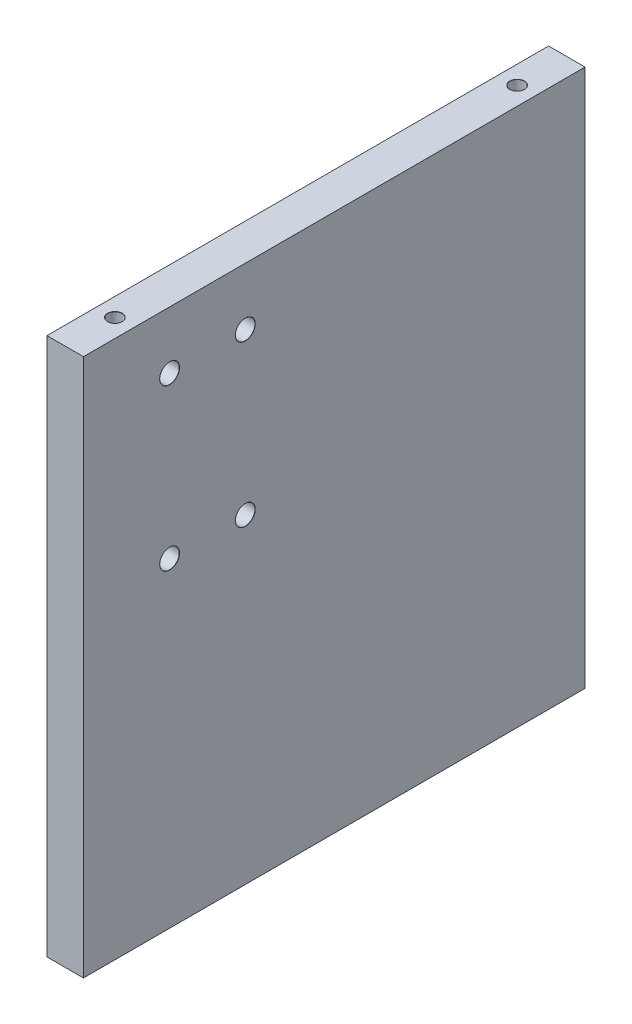
from build123d import *

# Parameters (mm, degrees)
SKETCH1_W                             = 87.3
SKETCH1_H                             = 93.65
BOSS_EXTRUDE1_DEPTH                   = 6.35
TAP_DRILL_FOR_M3X0_5_TAP1_D           = 2.5
TAP_DRILL_FOR_M3X0_5_TAP1_DEPTH       = 10
TAP_DRILL_FOR_M3X0_5_TAP1_CSINK_D     = 2.55
TAP_DRILL_FOR_M3X0_5_TAP1_CSINK_ANGLE = 90
TAP_DRILL_FOR_M3X0_5_TAP1_TIP         = 0.751075774
TAP_DRILL_FOR_M3X0_5_TAP2_D           = 2.5
TAP_DRILL_FOR_M3X0_5_TAP2_DEPTH       = 9.248924226
TAP_DRILL_FOR_M3X0_5_TAP2_CSINK_D     = 2.55
TAP_DRILL_FOR_M3X0_5_TAP2_CSINK_ANGLE = 90
TAP_DRILL_FOR_M3X0_5_TAP2_TIP         = 0.751075774
M3_CLEARANCE_HOLE2_D                  = 3.4
M3_CLEARANCE_HOLE2_CSINK_D            = 3.45
M3_CLEARANCE_HOLE2_CSINK_ANGLE        = 90


with BuildPart() as part:
    # Sketch1 → Boss-Extrude1 (new body)
    with BuildSketch(Plane(origin=(0, 0, 0), x_dir=(0, 0, -1), z_dir=(1, 0, 0))):
        Rectangle(SKETCH1_W, SKETCH1_H)
    extrude(amount=BOSS_EXTRUDE1_DEPTH)

    # Tap Drill for M3x0.5 Tap1
    with Locations(Plane(origin=(0, 46.825, 0), x_dir=(1, 0, 0), z_dir=(0, 1, 0))):
        with Locations((3.175, 35), (3.175, -35)):
            CounterSinkHole(TAP_DRILL_FOR_M3X0_5_TAP1_D / 2, TAP_DRILL_FOR_M3X0_5_TAP1_CSINK_D / 2, depth=TAP_DRILL_FOR_M3X0_5_TAP1_DEPTH, counter_sink_angle=TAP_DRILL_FOR_M3X0_5_TAP1_CSINK_ANGLE)
            with Locations((0, 0, -(TAP_DRILL_FOR_M3X0_5_TAP1_DEPTH + TAP_DRILL_FOR_M3X0_5_TAP1_TIP / 2))):  # 118° drill point
                Cone(0, TAP_DRILL_FOR_M3X0_5_TAP1_D / 2, TAP_DRILL_FOR_M3X0_5_TAP1_TIP, mode=Mode.SUBTRACT)

    # Tap Drill for M3x0.5 Tap2
    with Locations(Plane(origin=(0, -46.825, 0), x_dir=(-1, 0, 0), z_dir=(0, -1, 0))):
        with Locations((-3.175, -35), (-3.175, 35)):
            CounterSinkHole(TAP_DRILL_FOR_M3X0_5_TAP2_D / 2, TAP_DRILL_FOR_M3X0_5_TAP2_CSINK_D / 2, depth=TAP_DRILL_FOR_M3X0_5_TAP2_DEPTH, counter_sink_angle=TAP_DRILL_FOR_M3X0_5_TAP2_CSINK_ANGLE)
            with Locations((0, 0, -(TAP_DRILL_FOR_M3X0_5_TAP2_DEPTH + TAP_DRILL_FOR_M3X0_5_TAP2_TIP / 2))):  # 118° drill point
                Cone(0, TAP_DRILL_FOR_M3X0_5_TAP2_D / 2, TAP_DRILL_FOR_M3X0_5_TAP2_TIP, mode=Mode.SUBTRACT)

    # M3 Clearance Hole2 (through all)
    with Locations(Plane(origin=(6.35, 0, 0), x_dir=(0, 0, -1), z_dir=(1, 0, 0))):
        with Locations((-28.65, 36.825), (-15.48, 36.825), (-15.48, 8.885), (-28.65, 8.885)):
            CounterSinkHole(M3_CLEARANCE_HOLE2_D / 2, M3_CLEARANCE_HOLE2_CSINK_D / 2, counter_sink_angle=M3_CLEARANCE_HOLE2_CSINK_ANGLE)


solid = part.part
